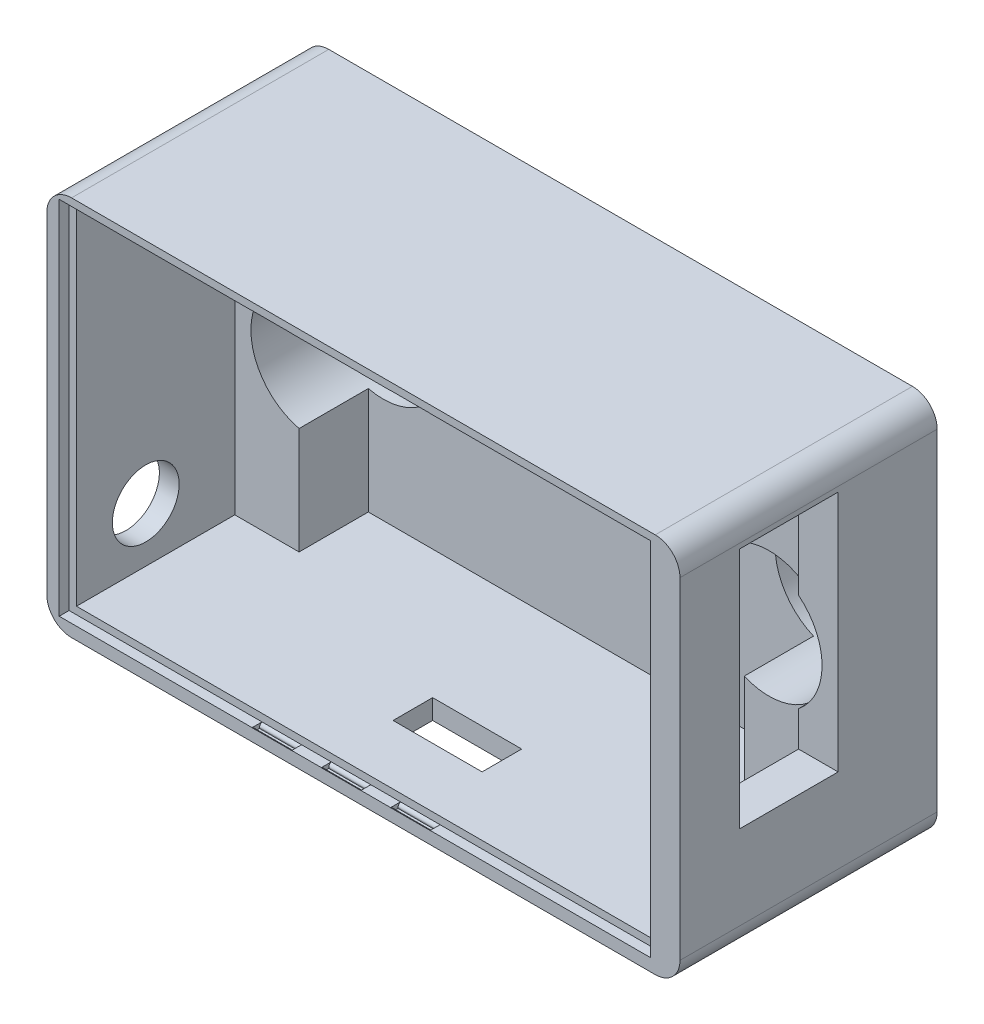
from build123d import *

# Parameters (mm, degrees)
SKETCH1_W           = 64
SKETCH1_H           = 38.5
BOSS_EXTRUDE1_DEPTH = 26
SKETCH2_W           = 58
SKETCH2_H           = 35
CUT_EXTRUDE1_DEPTH  = 17
SKETCH4_W           = 45
SKETCH4_H           = 35
CUT_EXTRUDE3_DEPTH  = 7
SKETCH5_R           = 6.375
CUT_EXTRUDE4_DEPTH  = 12
SKETCH6_W           = 9.989337028
SKETCH6_H           = 24.5
CUT_EXTRUDE5_DEPTH  = 17
SKETCH7_R           = 3.375
CUT_EXTRUDE6_DEPTH  = 7
SKETCH8_W           = 9
SKETCH8_H           = 4
CUT_EXTRUDE7_DEPTH  = 7
FILLET1_R           = 2.5
SKETCH10_W          = 59.5
SKETCH10_H          = 0.75
CUT_EXTRUDE8_DEPTH  = 1
SKETCH11_W          = 59.75
SKETCH11_H          = 0.75
CUT_EXTRUDE9_DEPTH  = 1
SKETCH12_W          = 1
SKETCH12_H          = 36.5
SKETCH12_W_2        = 0.75
CUT_EXTRUDE10_DEPTH = 1
SKETCH13_W          = 4
SKETCH13_H          = 0.45
CUT_EXTRUDE11_DEPTH = 0.45
FILLET2_R           = 0.4
SKETCH14_W          = 4
SKETCH14_H          = 0.45
CUT_EXTRUDE12_DEPTH = 0.45
FILLET3_R           = 0.4


with BuildPart() as part:
    # Sketch1 → Boss-Extrude1 (new body)
    with BuildSketch(Plane.XY):
        with Locations((32, 19.25)):
            Rectangle(SKETCH1_W, SKETCH1_H)
    extrude(amount=BOSS_EXTRUDE1_DEPTH)

    # Sketch2 → Cut-Extrude1 (cut)
    with BuildSketch(Plane.XY.offset(26)):
        with Locations((31, 19.5)):
            Rectangle(SKETCH2_W, SKETCH2_H)
    extrude(amount=-CUT_EXTRUDE1_DEPTH, mode=Mode.SUBTRACT)

    # Sketch4 → Cut-Extrude3 (cut)
    with BuildSketch(Plane.XY.offset(9)):
        with Locations((31, 19.5)):
            Rectangle(SKETCH4_W, SKETCH4_H)
    extrude(amount=-CUT_EXTRUDE3_DEPTH, mode=Mode.SUBTRACT)

    # Sketch5 → Cut-Extrude4 (cut)
    with BuildSketch(Plane(origin=(0, 0, 0), x_dir=(-1, 0, 0), z_dir=(0, 0, -1))):
        with Locations((-56, 19.5)):
            Circle(SKETCH5_R)
        with Locations((-10.002659036, 19.005404936)):
            Circle(SKETCH5_R)
    extrude(amount=-CUT_EXTRUDE4_DEPTH, mode=Mode.SUBTRACT)

    # Sketch6 → Cut-Extrude5 (cut)
    with BuildSketch(Plane(origin=(64, 0, 0), x_dir=(0, 0, -1), z_dir=(1, 0, 0))):
        with Locations((-15.005331486, 23.25)):
            Rectangle(SKETCH6_W, SKETCH6_H)
    extrude(amount=-CUT_EXTRUDE5_DEPTH, mode=Mode.SUBTRACT)

    # Sketch7 → Cut-Extrude6 (cut)
    with BuildSketch(Plane.ZY):
        with Locations((18, 7.5)):
            Circle(SKETCH7_R)
    extrude(amount=-CUT_EXTRUDE6_DEPTH, mode=Mode.SUBTRACT)

    # Sketch8 → Cut-Extrude7 (cut)
    with BuildSketch(Plane.XZ):
        with Locations((32.5, 17)):
            Rectangle(SKETCH8_W, SKETCH8_H)
    extrude(amount=-CUT_EXTRUDE7_DEPTH, mode=Mode.SUBTRACT)

    # Fillet1
    fillet1_edges = [part.edges().sort_by_distance(p)[0] for p in [
        (0, 38.5, 13),
        (64, 38.5, 13),
        (64, 0, 13),
        (0, 0, 13),
    ]]
    fillet(fillet1_edges, radius=FILLET1_R)

    # Sketch10 → Cut-Extrude8 (cut)
    with BuildSketch(Plane.XY.offset(26)):
        with Locations((31.25, 37.375)):
            Rectangle(SKETCH10_W, SKETCH10_H)
    extrude(amount=-CUT_EXTRUDE8_DEPTH, mode=Mode.SUBTRACT)

    # Sketch11 → Cut-Extrude9 (cut)
    with BuildSketch(Plane.XY.offset(26)):
        with Locations((31.125, 1.625)):
            Rectangle(SKETCH11_W, SKETCH11_H)
    extrude(amount=-CUT_EXTRUDE9_DEPTH, mode=Mode.SUBTRACT)

    # Sketch12 → Cut-Extrude10 (cut)
    with BuildSketch(Plane.XY.offset(26)):
        with Locations((60.5, 19.5)):
            Rectangle(SKETCH12_W, SKETCH12_H)
        with Locations((1.625, 19.5)):
            Rectangle(SKETCH12_W_2, SKETCH12_H)
    extrude(amount=-CUT_EXTRUDE10_DEPTH, mode=Mode.SUBTRACT)

    # Sketch13 → Cut-Extrude11 (cut)
    with BuildSketch(Plane(origin=(0, 1.25, 0), x_dir=(1, 0, 0), z_dir=(0, 1, 0))):
        with Locations((29.75, -25.475)):
            Rectangle(SKETCH13_W, SKETCH13_H)
        with Locations((22.75, -25.475)):
            Rectangle(SKETCH13_W, SKETCH13_H)
        with Locations((36.75, -25.475)):
            Rectangle(SKETCH13_W, SKETCH13_H)
    extrude(amount=-CUT_EXTRUDE11_DEPTH, mode=Mode.SUBTRACT)

    # Fillet2
    # the kernel refuses this fillet: 0.4 mm, written as the material it takes off along each edge
    with BuildSketch(Plane(origin=(34.75, 1.25, 25.25), x_dir=(0, 0, -1), z_dir=(1, 0, 0)), Plane(origin=(20.75, 1.25, 25.25), x_dir=(0, 0, -1), z_dir=(1, 0, 0)), Plane(origin=(27.75, 1.25, 25.25), x_dir=(0, 0, -1), z_dir=(1, 0, 0))) as fillet2_piece_1:
        with BuildLine():
            CenterArc((0.4, -0.370809924), FILLET2_R, 112.024312837, 67.975687163)
            Line((0, -0.370809924), (0, 0))
            Line((0, 0), (0.25, 0))
        make_face()
    extrude(amount=4, mode=Mode.SUBTRACT)
    with BuildSketch(Plane(origin=(38.75, 1.25, 25.7), x_dir=(0, 0, 1), z_dir=(-1, 0, 0)), Plane(origin=(24.75, 1.25, 25.7), x_dir=(0, 0, 1), z_dir=(-1, 0, 0)), Plane(origin=(31.75, 1.25, 25.7), x_dir=(0, 0, 1), z_dir=(-1, 0, 0))) as fillet2_piece_2:
        with BuildLine():
            CenterArc((FILLET2_R, -FILLET2_R), FILLET2_R, 90, 90)
            Line((0, -FILLET2_R), (0, 0))
            Line((0, 0), (FILLET2_R, 0))
        make_face()
    extrude(amount=4, mode=Mode.SUBTRACT)

    # Sketch14 → Cut-Extrude12 (cut)
    with BuildSketch(Plane.XZ.offset(-37.75)):
        with Locations((29.75, 25.475)):
            Rectangle(SKETCH14_W, SKETCH14_H)
        with Locations((36.75, 25.475)):
            Rectangle(SKETCH14_W, SKETCH14_H)
        with Locations((22.75, 25.475)):
            Rectangle(SKETCH14_W, SKETCH14_H)
    extrude(amount=-CUT_EXTRUDE12_DEPTH, mode=Mode.SUBTRACT)

    # Fillet3
    # the kernel refuses this fillet: 0.4 mm, written as the material it takes off along each edge
    with BuildSketch(Plane(origin=(24.75, 37.75, 25.7), x_dir=(0, 0, 1), z_dir=(-1, 0, 0))) as fillet3_piece_1:
        with BuildLine():
            CenterArc((FILLET3_R, FILLET3_R), FILLET3_R, 180, 90)
            Line((0, FILLET3_R), (0, 0))
            Line((0, 0), (FILLET3_R, 0))
        make_face()
    extrude(amount=4, mode=Mode.SUBTRACT)
    with BuildSketch(Plane(origin=(20.75, 37.75, 25.25), x_dir=(0, 0, -1), z_dir=(1, 0, 0))) as fillet3_piece_2:
        with BuildLine():
            CenterArc((0.4, 0.370809924), FILLET3_R, 180, 67.975687163)
            Line((0, 0.370809924), (0, 0))
            Line((0, 0), (0.25, 0))
        make_face()
    extrude(amount=4, mode=Mode.SUBTRACT)
    with BuildSketch(Plane(origin=(38.75, 37.75, 25.25), x_dir=(0, 0, -1), z_dir=(-1, 0, 0)), Plane(origin=(31.75, 37.75, 25.25), x_dir=(0, 0, -1), z_dir=(-1, 0, 0))) as fillet3_piece_3:
        with BuildLine():
            CenterArc((0.4, -0.370809924), FILLET3_R, 112.024312837, 67.975687163)
            Line((0, -0.370809924), (0, 0))
            Line((0, 0), (0.25, 0))
        make_face()
    extrude(amount=4, mode=Mode.SUBTRACT)
    with BuildSketch(Plane(origin=(34.75, 37.75, 25.7), x_dir=(0, 0, 1), z_dir=(1, 0, 0)), Plane(origin=(27.75, 37.75, 25.7), x_dir=(0, 0, 1), z_dir=(1, 0, 0))) as fillet3_piece_4:
        with BuildLine():
            CenterArc((FILLET3_R, -FILLET3_R), FILLET3_R, 90, 90)
            Line((0, -FILLET3_R), (0, 0))
            Line((0, 0), (FILLET3_R, 0))
        make_face()
    extrude(amount=4, mode=Mode.SUBTRACT)


solid = part.part
